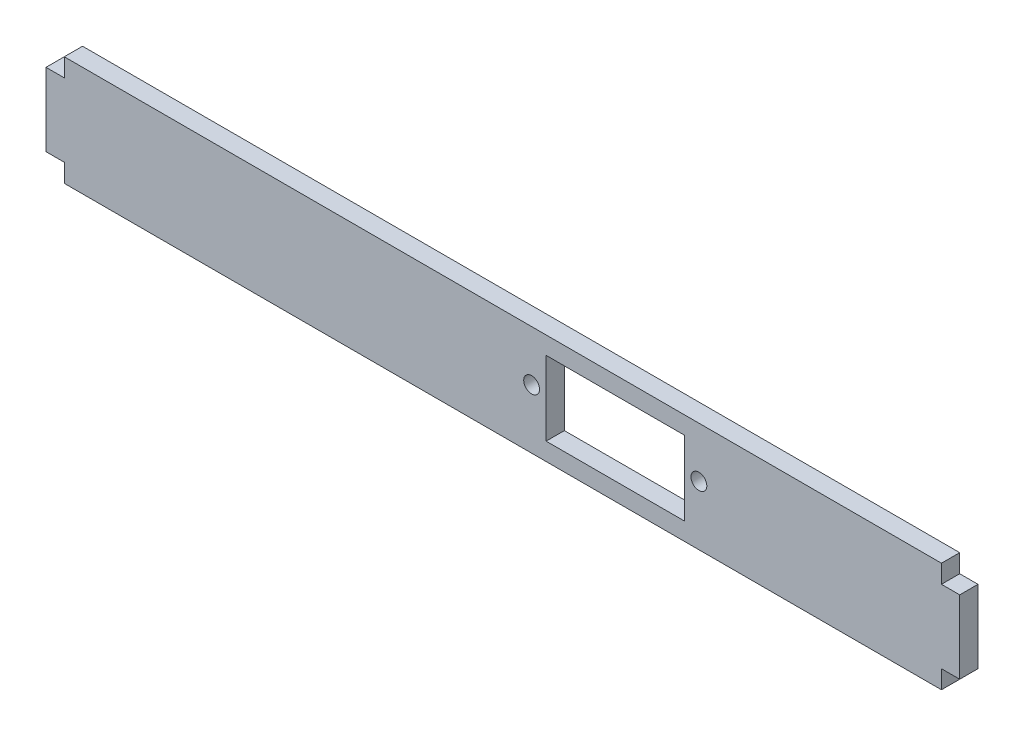
from build123d import *

# Parameters (mm, degrees)
SKETCH1_W               = 150
SKETCH1_H               = 18
BOSS_EXTRUDE1_DEPTH     = 3
SKETCH2_W               = 22.7
SKETCH2_H               = 12.2
CUT_EXTRUDE1_DEPTH      = 3
SKETCH3_R               = 1.2
BOSS_EXTRUDE2_DEPTH     = 3
SKETCH4_R               = 1.3
CUT_EXTRUDE2_DEPTH      = 3
SKETCH5_W               = 3
SKETCH5_H               = 3
CUT_EXTRUDE3_DEPTH      = 3
MIRROR2_COPY_1_SKETCH_W = 3
MIRROR2_COPY_1_SKETCH_H = 3
MIRROR2_COPY_1_DEPTH    = 3
MIRROR2_COPY_2_SKETCH_W = 3
MIRROR2_COPY_2_SKETCH_H = 3
MIRROR2_COPY_2_DEPTH    = 3


with BuildPart() as part:
    # Sketch1 → Boss-Extrude1 (new body)
    with BuildSketch(Plane.XY):
        Rectangle(SKETCH1_W, SKETCH1_H)
    extrude(amount=BOSS_EXTRUDE1_DEPTH)

    # Sketch2 → Cut-Extrude1 (cut)
    with BuildSketch(Plane(origin=(0, 0, 0), x_dir=(-1, 0, 0), z_dir=(0, 0, -1))):
        with Locations((-18.45, 0)):
            Rectangle(SKETCH2_W, SKETCH2_H)
    extrude(amount=-CUT_EXTRUDE1_DEPTH, mode=Mode.SUBTRACT)

    # Sketch3 → Boss-Extrude2 (add)
    with BuildSketch(Plane.XY.offset(3)):
        with Locations((32.175, 0.1)):
            Circle(SKETCH3_R)
    extrude(amount=-BOSS_EXTRUDE2_DEPTH)

    # Sketch4 → Cut-Extrude2 (cut)
    with BuildSketch(Plane(origin=(0, 0, 0), x_dir=(-1, 0, 0), z_dir=(0, 0, -1))):
        with Locations((-32.18, 0.723190071)):
            Circle(SKETCH4_R)
        with Locations((-4.72, 0.723190071)):
            Circle(SKETCH4_R)
    extrude(amount=-CUT_EXTRUDE2_DEPTH, mode=Mode.SUBTRACT)

    # Sketch5 → Cut-Extrude3 (cut)
    with BuildSketch(Plane(origin=(0, 0, 0), x_dir=(-1, 0, 0), z_dir=(0, 0, -1))):
        with Locations((-73.5, 7.5)):
            Rectangle(SKETCH5_W, SKETCH5_H)
    cut_extrude3 = extrude(amount=-CUT_EXTRUDE3_DEPTH, mode=Mode.SUBTRACT)

    # Mirror1: Cut-Extrude3 across plane
    add(cut_extrude3.mirror(Plane.ZX), mode=Mode.SUBTRACT)

    # Mirror2 copy 1 sketch → Mirror2 copy 1 (cut)
    with BuildSketch(Plane(origin=(0, 0, 0), x_dir=(1, 0, 0), z_dir=(0, 0, -1))):
        with Locations((-73.5, 7.5)):
            Rectangle(MIRROR2_COPY_1_SKETCH_W, MIRROR2_COPY_1_SKETCH_H)
    extrude(amount=-MIRROR2_COPY_1_DEPTH, mode=Mode.SUBTRACT)

    # Mirror2 copy 2 sketch → Mirror2 copy 2 (cut)
    with BuildSketch(Plane(origin=(0, 0, 0), x_dir=(1, 0, 0), z_dir=(0, 0, -1))):
        with Locations((-73.5, -7.5)):
            Rectangle(MIRROR2_COPY_2_SKETCH_W, MIRROR2_COPY_2_SKETCH_H)
    extrude(amount=-MIRROR2_COPY_2_DEPTH, mode=Mode.SUBTRACT)


solid = part.part
